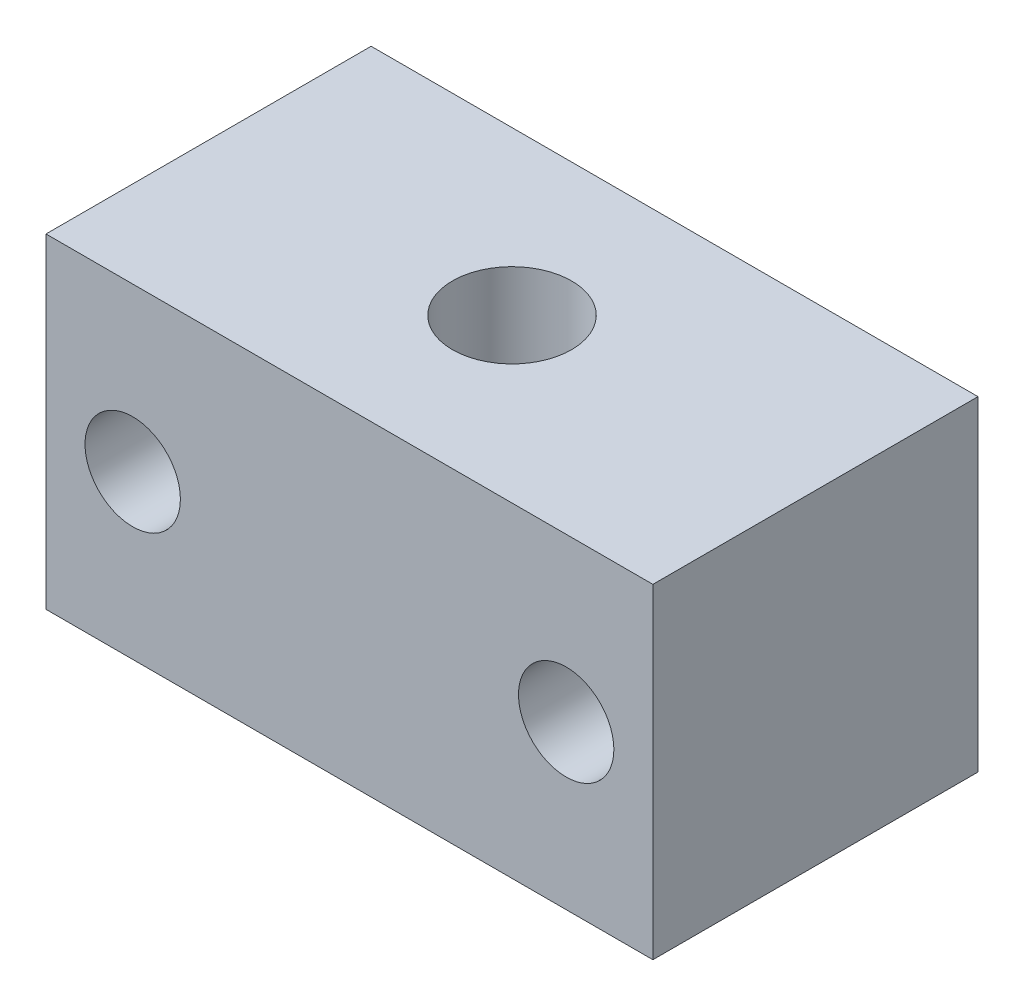
from build123d import *

# Parameters (mm, degrees)
SKETCH_1_W          = 28
SKETCH_1_H          = 15
SKETCH_1_R          = 2.75
EXTRUDE_1_DEPTH     = 7.5
SKETCH_2_R          = 2.2
CUT_EXTRUDE_1_DEPTH = 15


with BuildPart() as part:
    # 草图1 → 凸台-拉伸1 (new, symmetric)
    with BuildSketch(Plane(origin=(0, 0, 0), x_dir=(1, 0, 0), z_dir=(0, 1, 0))):
        Rectangle(SKETCH_1_W, SKETCH_1_H)
        Circle(SKETCH_1_R, mode=Mode.SUBTRACT)
    extrude(amount=EXTRUDE_1_DEPTH, both=True)

    # 草图2 → 切除-拉伸1 (cut)
    with BuildSketch(Plane.XY.offset(7.5)):
        with Locations((-10, 0)):
            Circle(SKETCH_2_R)
        with Locations((10, 0)):
            Circle(SKETCH_2_R)
    extrude(amount=-CUT_EXTRUDE_1_DEPTH, mode=Mode.SUBTRACT)


solid = part.part
